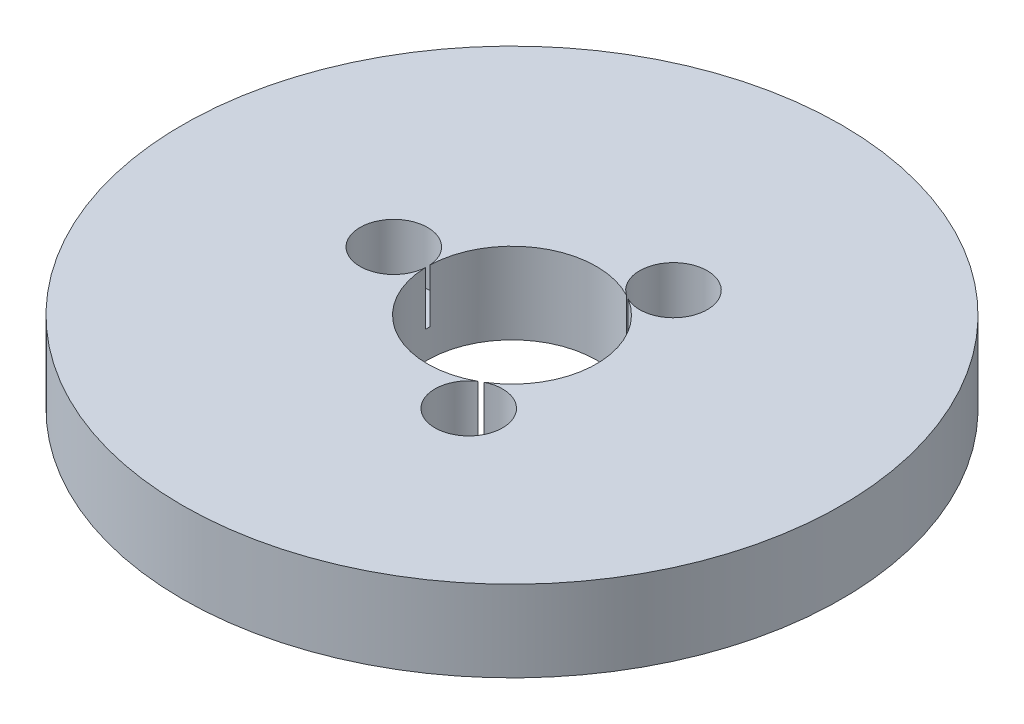
from build123d import *

# Parameters (mm, degrees)
SKETCH1_R           = 97.5
BOSS_EXTRUDE1_DEPTH = 24
SKETCH2_R           = 25
CUT_EXTRUDE1_DEPTH  = 140.958922545
SKETCH3_R           = 10
CUT_EXTRUDE2_DEPTH  = 15.823761425
CIRPATTERN1_COUNT   = 3


with BuildPart() as part:
    # Sketch1 → Boss-Extrude1 (new body)
    with BuildSketch(Plane(origin=(0, 0, 0), x_dir=(1, 0, 0), z_dir=(0, 1, 0))):
        Circle(SKETCH1_R)
    extrude(amount=BOSS_EXTRUDE1_DEPTH)

    # Sketch2 → Cut-Extrude1 (cut, through all)
    with BuildSketch(Plane(origin=(0, 0, 0), x_dir=(1, 0, 0), z_dir=(0, 1, 0))):
        Circle(SKETCH2_R)
    extrude(amount=CUT_EXTRUDE1_DEPTH, mode=Mode.SUBTRACT)

    # Sketch3 → Cut-Extrude2 (cut)
    with BuildSketch(Plane(origin=(0, 24, 0), x_dir=(1, 0, 0), z_dir=(0, 1, 0))):
        with Locations((-34.969247783, 0)):
            Circle(SKETCH3_R)
    cut_extrude2 = extrude(amount=-CUT_EXTRUDE2_DEPTH, mode=Mode.SUBTRACT)

    # CirPattern1: Cut-Extrude2 ×3 about axis
    cirpattern1_axis = Axis((0, 0, 0), (0, 1, 0))
    for i in range(1, CIRPATTERN1_COUNT):
        add(cut_extrude2.rotate(cirpattern1_axis, i * 360 / CIRPATTERN1_COUNT), mode=Mode.SUBTRACT)


solid = part.part
